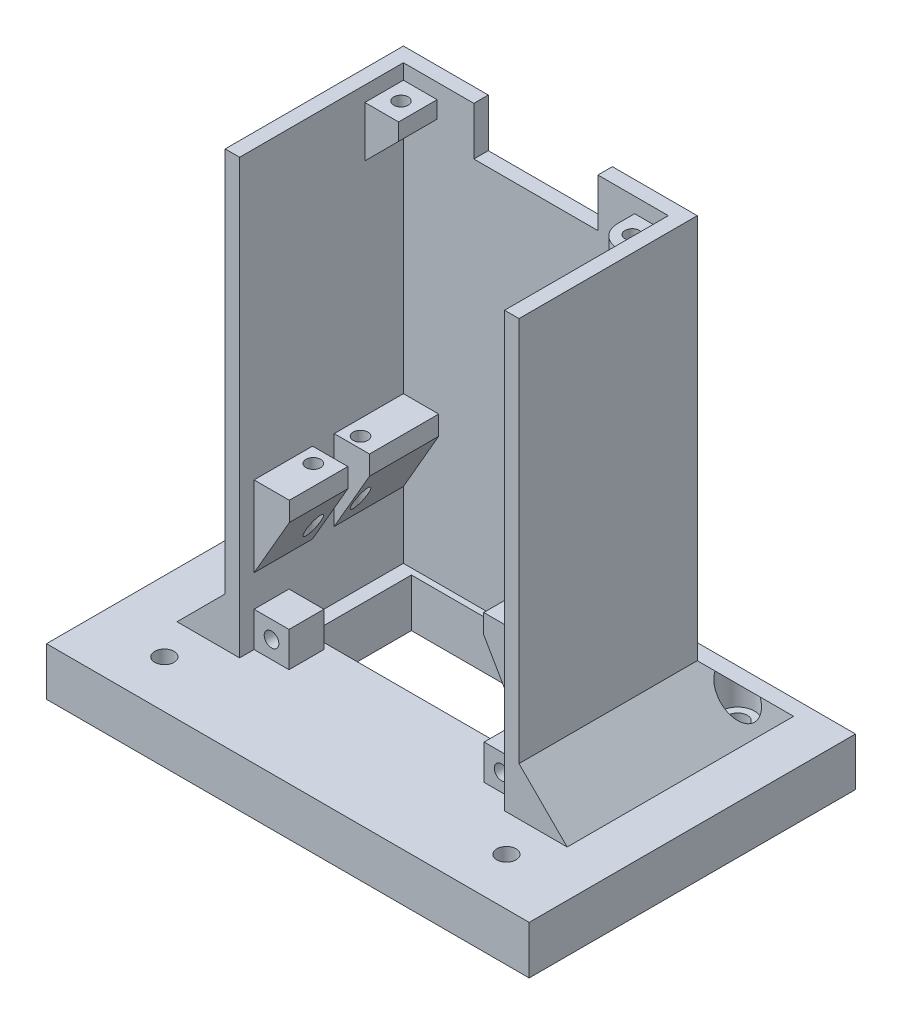
from build123d import *

# Parameters (mm, degrees)
SKETCH1_W                = 55
SKETCH1_H                = 80
BACKPANEL_DEPTH          = 3
SKETCH2_W                = 7.325
SKETCH2_H                = 4
MOTORMOUNT_DEPTH         = 34
SKETCH3_W                = 37
SKETCH3_H                = 80
SIDEPANEL2_DEPTH         = 3
SKETCH4_W                = 37
SKETCH4_H                = 80
SIDEPANEL1_DEPTH         = 3
MOTORSUPPORTANGLES_DEPTH = 34
MOTORHOLESSET1_REACH     = 92.957
SKETCH5_R                = 1.515
MOTORHOLESSET2_REACH     = 92.957
SKETCH5_3_R              = 1.515
SKETCH7_W                = 61
SKETCH7_H                = 37
BOTTOMPLATE_DEPTH        = 3
SKETCH8_W                = 61
SKETCH8_H                = 3
CUT_EXTRUDE1_DEPTH       = 37
SKETCH20_W               = 100.196149356
SKETCH20_H               = 67.738241818
SKETCH20_R               = 2
BOSS_EXTRUDE8_DEPTH      = 20
BOSS_EXTRUDE10_DEPTH     = 10
BOSS_EXTRUDE11_DEPTH     = 8
SKETCH24_R               = 1.505
CUT_EXTRUDE6_DEPTH       = 4
SKETCH25_W               = 7.25
SKETCH25_H               = 7.25
BOSS_EXTRUDE12_DEPTH     = 7.25
SKETCH26_R               = 1.515
CUT_EXTRUDE7_DEPTH       = 7.25
CUT_EXTRUDE8_REACH       = 113.941
SKETCH27_W               = 7.325
SKETCH27_H               = 4.500198619
FILLET3_R                = 4.5
SKETCH28_W               = 55
SKETCH28_H               = 16.687272165
CUT_EXTRUDE9_DEPTH       = 3
SKETCH30_W               = 100.196149356
SKETCH30_H               = 67.738241818
CUT_EXTRUDE10_DEPTH      = 10
CHAMFER1_SIZE            = 10
CHAMFER2_SIZE            = 10
CHAMFER3_SIZE            = 10
SKETCH31_R               = 3.5
CUT_EXTRUDE11_DEPTH      = 10
SKETCH32_W               = 49.142704434
SKETCH32_H               = 21.220713278
CUT_EXTRUDE12_DEPTH      = 10
SKETCH33_W               = 25.755482036
SKETCH33_H               = 3
CUT_EXTRUDE13_DEPTH      = 10


with BuildPart() as part:
    # Sketch1 → BackPanel (new body)
    with BuildSketch(Plane.XY):
        with Locations((27.5, 40)):
            Rectangle(SKETCH1_W, SKETCH1_H)
    extrude(amount=BACKPANEL_DEPTH)

    # Sketch2 → MotorMount (add)
    with BuildSketch(Plane.XY.offset(3)):
        with Locations((3.6625, 18.5)):
            Rectangle(SKETCH2_W, SKETCH2_H)
        with Locations((51.3375, 18.5)):
            Rectangle(SKETCH2_W, SKETCH2_H)
    extrude(amount=MOTORMOUNT_DEPTH)

    # Sketch3 → SidePanel2 (add)
    with BuildSketch(Plane.ZY):
        with Locations((18.5, 40)):
            Rectangle(SKETCH3_W, SKETCH3_H)
    extrude(amount=SIDEPANEL2_DEPTH)

    # Sketch4 → SidePanel1 (add)
    with BuildSketch(Plane(origin=(55, 0, 0), x_dir=(0, 0, -1), z_dir=(1, 0, 0))):
        with Locations((-18.5, 40)):
            Rectangle(SKETCH4_W, SKETCH4_H)
    extrude(amount=SIDEPANEL1_DEPTH)

    # Sketch6 → MotorSupportAngles (add)
    with BuildSketch(Plane.XY.offset(37)):
        Polygon((7.325, 16.5), (0, 3.812727835), (0, 16.5), align=None)
        Polygon((47.675, 16.5), (55, 16.5), (55, 3.812727835), align=None)
    extrude(amount=-MOTORSUPPORTANGLES_DEPTH)

    # MotorHolesSet1: up to this plane
    motorholesset1_end = Plane(origin=(7.325, 16.5, -11.65), z_dir=(0.866025403784438, -0.5000000000000012, 0))
    # Sketch5 → MotorHolesSet1 (cut, up to the surface)
    with BuildSketch(Plane(origin=(0, 20.5, 0), x_dir=(1, 0, 0), z_dir=(0, 1, 0)), mode=Mode.PRIVATE) as motorholesset1_sk1:
        with Locations(Location((3.2, -15.1, 0), (0, 0, 270))):
            Circle(SKETCH5_R)
    motorholesset1_tool1 = split(extrude(motorholesset1_sk1.sketch, amount=-MOTORHOLESSET1_REACH, mode=Mode.PRIVATE), bisect_by=motorholesset1_end, keep=Keep.BOTH, mode=Mode.PRIVATE)
    add(motorholesset1_tool1.solids().sort_by_distance((3.2, 20.5, 15.1))[0], mode=Mode.SUBTRACT)
    # Sketch5 → MotorHolesSet1 (cut, up to the surface)
    with BuildSketch(Plane(origin=(0, 20.5, 0), x_dir=(1, 0, 0), z_dir=(0, 1, 0)), mode=Mode.PRIVATE) as motorholesset1_sk2:
        with Locations(Location((3.2, -24.9, 0), (0, 0, 270))):
            Circle(SKETCH5_R)
    motorholesset1_tool2 = split(extrude(motorholesset1_sk2.sketch, amount=-MOTORHOLESSET1_REACH, mode=Mode.PRIVATE), bisect_by=motorholesset1_end, keep=Keep.BOTH, mode=Mode.PRIVATE)
    add(motorholesset1_tool2.solids().sort_by_distance((3.2, 20.5, 24.9))[0], mode=Mode.SUBTRACT)

    # MotorHolesSet2: up to this plane
    motorholesset2_end = Plane(origin=(55, 3.812727835, -11.65), z_dir=(-0.866025403784438, -0.5000000000000011, 0))
    # Sketch5<3> → MotorHolesSet2 (cut, up to the surface)
    with BuildSketch(Plane(origin=(0, 20.5, 0), x_dir=(1, 0, 0), z_dir=(0, 1, 0)), mode=Mode.PRIVATE) as motorholesset2_sk1:
        with Locations(Location((51.8, -15.1, 0), (0, 0, 270))):
            Circle(SKETCH5_3_R)
    motorholesset2_tool1 = split(extrude(motorholesset2_sk1.sketch, amount=-MOTORHOLESSET2_REACH, mode=Mode.PRIVATE), bisect_by=motorholesset2_end, keep=Keep.BOTH, mode=Mode.PRIVATE)
    add(motorholesset2_tool1.solids().sort_by_distance((51.8, 20.5, 15.1))[0], mode=Mode.SUBTRACT)
    # Sketch5<3> → MotorHolesSet2 (cut, up to the surface)
    with BuildSketch(Plane(origin=(0, 20.5, 0), x_dir=(1, 0, 0), z_dir=(0, 1, 0)), mode=Mode.PRIVATE) as motorholesset2_sk2:
        with Locations(Location((51.8, -24.9, 0), (0, 0, 270))):
            Circle(SKETCH5_3_R)
    motorholesset2_tool2 = split(extrude(motorholesset2_sk2.sketch, amount=-MOTORHOLESSET2_REACH, mode=Mode.PRIVATE), bisect_by=motorholesset2_end, keep=Keep.BOTH, mode=Mode.PRIVATE)
    add(motorholesset2_tool2.solids().sort_by_distance((51.8, 20.5, 24.9))[0], mode=Mode.SUBTRACT)

    # Sketch7 → BottomPlate (add)
    with BuildSketch(Plane.XZ):
        with Locations((27.5, 18.5)):
            Rectangle(SKETCH7_W, SKETCH7_H)
    extrude(amount=BOTTOMPLATE_DEPTH)

    # Sketch8 → Cut-Extrude1 (cut)
    with BuildSketch(Plane.XY.offset(37)):
        with Locations((27.5, -1.5)):
            Rectangle(SKETCH8_W, SKETCH8_H)
    extrude(amount=-CUT_EXTRUDE1_DEPTH, mode=Mode.SUBTRACT)



with BuildPart() as body_2:
    # Sketch20 → Boss-Extrude8 (new body)
    with BuildSketch(Plane(origin=(0, -30, 0), x_dir=(-1, 0, 0), z_dir=(0, -1, 0))):
        with Locations((-27.5, -20.61971831)):
            Rectangle(SKETCH20_W, SKETCH20_H)
        with Locations(Location((8, -44.61971831, 0), (0, 0, 90))):
            Circle(SKETCH20_R, mode=Mode.SUBTRACT)
        with Locations(Location((-63, -44.61971831, 0), (0, 0, 90))):
            Circle(SKETCH20_R, mode=Mode.SUBTRACT)
        with Locations(Location((-63, 3.38028169, 0), (0, 0, 90))):
            Circle(SKETCH20_R, mode=Mode.SUBTRACT)
        with Locations(Location((8, 3.38028169, 0), (0, 0, 90))):
            Circle(SKETCH20_R, mode=Mode.SUBTRACT)
    extrude(amount=-BOSS_EXTRUDE8_DEPTH)


with BuildPart() as part_1:
    add(part.part)

    add(body_2.part)  # Boss-Extrude10 merges body 2
    # Sketch21 → Boss-Extrude10 (add)
    with BuildSketch(Plane.XZ):
        Polygon((-3, 0), (58, 0), (58, 37), (55, 37), (55, 3), (0, 3), (0, 37), (-3, 37), align=None)
    extrude(amount=BOSS_EXTRUDE10_DEPTH)

    # Sketch22 → Boss-Extrude11 (add)
    with BuildSketch(Plane.XY.offset(3)):
        Polygon((0, 76.85), (7, 76.85), (7, 73.35), (0, 66.35), align=None)
        Polygon((55, 76.85), (55, 66.35), (48, 73.35), (48, 76.85), align=None)
    extrude(amount=BOSS_EXTRUDE11_DEPTH)

    # Sketch24 → Cut-Extrude6 (cut)
    with BuildSketch(Plane(origin=(0, 76.85, 0), x_dir=(1, 0, 0), z_dir=(0, 1, 0))):
        with Locations(Location((3.5, -7, 0), (0, 0, 180))):
            Circle(SKETCH24_R)
        with Locations(Location((51.5, -7, 0), (0, 0, 180))):
            Circle(SKETCH24_R)
    extrude(amount=-CUT_EXTRUDE6_DEPTH, mode=Mode.SUBTRACT)

    # Sketch25 → Boss-Extrude12 (add)
    with BuildSketch(Plane(origin=(0, -10, 0), x_dir=(1, 0, 0), z_dir=(0, 1, 0))):
        with Locations((3.625, -30.375)):
            Rectangle(SKETCH25_W, SKETCH25_H)
        with Locations((51.375, -30.375)):
            Rectangle(SKETCH25_W, SKETCH25_H)
    extrude(amount=BOSS_EXTRUDE12_DEPTH)

    # Sketch26 → Cut-Extrude7 (cut)
    with BuildSketch(Plane.XY.offset(34)):
        with Locations((3.625, -6.375)):
            Circle(SKETCH26_R)
        with Locations((51.375, -6.375)):
            Circle(SKETCH26_R)
    extrude(amount=-CUT_EXTRUDE7_DEPTH, mode=Mode.SUBTRACT)

    # Cut-Extrude8: up to this plane
    cut_extrude8_end = Plane(origin=(7.325, 16.5, -11.65), z_dir=(0.866025403784438, -0.5000000000000012, 0))
    # Sketch27 → Cut-Extrude8 (cut, up to the surface)
    with BuildSketch(Plane(origin=(0, 20.5, 0), x_dir=(1, 0, 0), z_dir=(0, 1, 0)), mode=Mode.PRIVATE) as cut_extrude8_sk1:
        with Locations((3.6625, -19.611135977)):
            Rectangle(SKETCH27_W, SKETCH27_H)
    cut_extrude8_tool1 = split(extrude(cut_extrude8_sk1.sketch, amount=-CUT_EXTRUDE8_REACH, mode=Mode.PRIVATE), bisect_by=cut_extrude8_end, keep=Keep.BOTH, mode=Mode.PRIVATE)
    add(cut_extrude8_tool1.solids().sort_by_distance((3.6625, 20.5, 19.611136))[0], mode=Mode.SUBTRACT)

    # Fillet3
    fillet3_edges = [part_1.edges().sort_by_distance(p)[0] for p in [
        (48, 75.1, 11),
    ]]
    fillet(fillet3_edges, radius=FILLET3_R)

    # Sketch28 → Cut-Extrude9 (cut)
    with BuildSketch(Plane.XY.offset(37)):
        with Locations((27.5, 12.156363918)):
            Rectangle(SKETCH28_W, SKETCH28_H)
    extrude(amount=-CUT_EXTRUDE9_DEPTH, mode=Mode.SUBTRACT)

    # Sketch30 → Cut-Extrude10 (cut)
    with BuildSketch(Plane.XZ.offset(30)):
        with Locations((27.5, 20.61971831)):
            Rectangle(SKETCH30_W, SKETCH30_H)
    extrude(amount=-CUT_EXTRUDE10_DEPTH, mode=Mode.SUBTRACT)

    # Chamfer1
    chamfer1_edges = [part_1.edges().sort_by_distance(p)[0] for p in [
        (-3, -10, 18.5),
    ]]
    chamfer(chamfer1_edges, length=CHAMFER1_SIZE)

    # Chamfer2
    chamfer2_edges = [part_1.edges().sort_by_distance(p)[0] for p in [
        (58, -10, 18.5),
    ]]
    chamfer(chamfer2_edges, length=CHAMFER2_SIZE)

    # Chamfer3
    # the kernel refuses this chamfer: 10 mm, written as the material it adds along each edge
    with BuildSketch(Plane(origin=(-38.71682988, -10, 0), x_dir=(0, -0.027495876610586317, -0.9996219169112968), z_dir=(1, 0, 0))) as chamfer3_piece_1_section:
        Polygon((CHAMFER3_SIZE * 0.999621916911, CHAMFER3_SIZE * 0.0274958766106), (-CHAMFER3_SIZE * 0.0274958766106, CHAMFER3_SIZE * 0.999621916911), (0, 0), align=None)
    chamfer3_piece_1 = extrude(amount=132.433659759, mode=Mode.PRIVATE)
    chamfer3_piece_1 = split(chamfer3_piece_1, bisect_by=Plane(origin=(-8.165213201, -5.165213201, -8.521451905), z_dir=(0.7071067811865476, -0.7071067811865476, 0)), keep=Keep.TOP, mode=Mode.PRIVATE)
    chamfer3_piece_1 = chamfer3_piece_1 - Plane(origin=(-8, -8.616619282, -3.38028169), x_dir=(0, 0, -1), z_dir=(0, -1, 0)) * Cylinder(2, 305, mode=Mode.PRIVATE)
    chamfer3_piece_1 = split(chamfer3_piece_1, bisect_by=Plane(origin=(-3, -8.616619282, -8.521451905), z_dir=(-1, 0, 0)), keep=Keep.TOP, mode=Mode.PRIVATE)
    add(chamfer3_piece_1)
    with BuildSketch(Plane(origin=(-38.71682988, -10, 0), x_dir=(0, -0.027495876610586317, -0.9996219169112968), z_dir=(1, 0, 0))) as chamfer3_piece_2_section:
        Polygon((CHAMFER3_SIZE * 0.999621916911, CHAMFER3_SIZE * 0.0274958766106), (-CHAMFER3_SIZE * 0.0274958766106, CHAMFER3_SIZE * 0.999621916911), (0, 0), align=None)
    chamfer3_piece_2 = extrude(amount=132.433659759, mode=Mode.PRIVATE)
    chamfer3_piece_2 = split(chamfer3_piece_2, bisect_by=Plane(origin=(-3, -6.7021107, -3.297961008), z_dir=(1, 0, 0)), keep=Keep.TOP, mode=Mode.PRIVATE)
    chamfer3_piece_2 = split(chamfer3_piece_2, bisect_by=Plane(origin=(58, -6.7021107, -3.297961008), z_dir=(-1, 0, 0)), keep=Keep.TOP, mode=Mode.PRIVATE)
    add(chamfer3_piece_2)
    with BuildSketch(Plane(origin=(-38.71682988, -10, 0), x_dir=(0, -0.027495876610586317, -0.9996219169112968), z_dir=(1, 0, 0))) as chamfer3_piece_3_section:
        Polygon((CHAMFER3_SIZE * 0.999621916911, CHAMFER3_SIZE * 0.0274958766106), (-CHAMFER3_SIZE * 0.0274958766106, CHAMFER3_SIZE * 0.999621916911), (0, 0), align=None)
    chamfer3_piece_3 = extrude(amount=132.433659759, mode=Mode.PRIVATE)
    chamfer3_piece_3 = split(chamfer3_piece_3, bisect_by=Plane(origin=(64.879020319, -6.879020319, -8.521451905), z_dir=(-0.7071067811865476, -0.7071067811865476, 0)), keep=Keep.TOP, mode=Mode.PRIVATE)
    chamfer3_piece_3 = chamfer3_piece_3 - Plane(origin=(63, -8.616619283, -3.38028169), x_dir=(0, 0, -1), z_dir=(0, -1, 0)) * Cylinder(2, 305, mode=Mode.PRIVATE)
    chamfer3_piece_3 = split(chamfer3_piece_3, bisect_by=Plane(origin=(58, -8.616619283, -8.521451905), z_dir=(1, 0, 0)), keep=Keep.TOP, mode=Mode.PRIVATE)
    add(chamfer3_piece_3)

    # Sketch31 → Cut-Extrude11 (cut)
    with BuildSketch(Plane(origin=(0, -10, 0), x_dir=(1, 0, 0), z_dir=(0, 1, 0))):
        with Locations(Location((63, 3.38028169, 0), (0, 0, 64.100886192))):
            Circle(SKETCH31_R)
        with Locations(Location((-8, 3.38028169, 0), (0, 0, 115.899113808))):
            Circle(SKETCH31_R)
    extrude(amount=CUT_EXTRUDE11_DEPTH, mode=Mode.SUBTRACT)

    # Sketch32 → Cut-Extrude12 (cut)
    with BuildSketch(Plane(origin=(0, -10, 0), x_dir=(1, 0, 0), z_dir=(0, 1, 0))):
        with Locations((27.5, -14.875)):
            Rectangle(SKETCH32_W, SKETCH32_H)
    extrude(amount=-CUT_EXTRUDE12_DEPTH, mode=Mode.SUBTRACT)

    # Sketch33 → Cut-Extrude13 (cut)
    with BuildSketch(Plane(origin=(0, 80, 0), x_dir=(1, 0, 0), z_dir=(0, 1, 0))):
        with Locations((27.5, -1.5)):
            Rectangle(SKETCH33_W, SKETCH33_H)
    extrude(amount=-CUT_EXTRUDE13_DEPTH, mode=Mode.SUBTRACT)


solid = part_1.part
